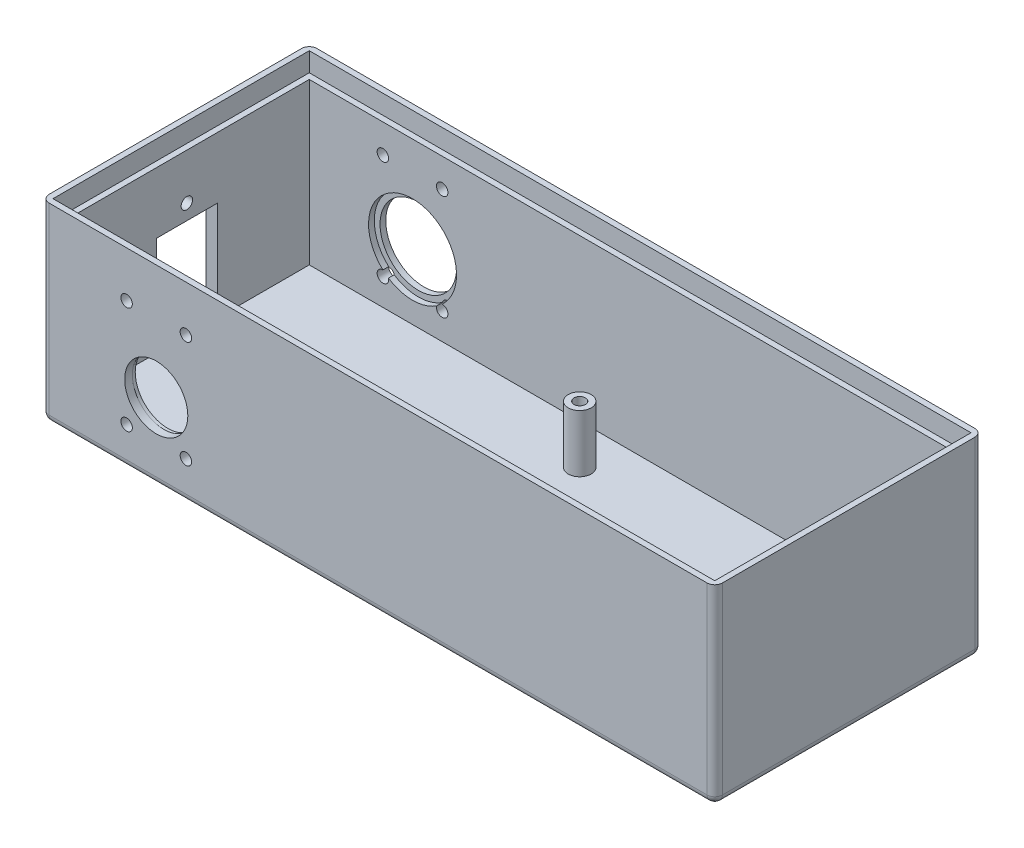
from build123d import *

# Parameters (mm, degrees)
SKETCH1_W           = 176
SKETCH1_H           = 70
BOSS_EXTRUDE1_DEPTH = 50
SKETCH2_W           = 170
SKETCH2_H           = 64
CUT_EXTRUDE1_DEPTH  = 47
SKETCH3_W           = 173
SKETCH3_H           = 67
CUT_EXTRUDE2_DEPTH  = 5
SKETCH4_R           = 3
SKETCH4_R_2         = 1.5
BOSS_EXTRUDE2_DEPTH = 15
CUT_EXTRUDE3_REACH  = 125.061
SKETCH5_R           = 10
SKETCH5_R_2         = 1.5
SKETCH6_R           = 11.5
CUT_EXTRUDE4_DEPTH  = 1.5
CUT_EXTRUDE5_REACH  = 125.061
SKETCH7_R           = 8.25
SKETCH7_R_2         = 1.5
SKETCH8_R           = 8.5
CUT_EXTRUDE6_DEPTH  = 1
FILLET1_R           = 2
CUT_EXTRUDE7_REACH  = 188.282
SKETCH9_R           = 1.5
SKETCH9_R_2         = 1
SKETCH9_W           = 16
SKETCH9_H           = 21


with BuildPart() as part:
    # Sketch1 → Boss-Extrude1 (new body)
    with BuildSketch(Plane(origin=(0, 0, 0), x_dir=(1, 0, 0), z_dir=(0, 1, 0))):
        Rectangle(SKETCH1_W, SKETCH1_H)
    extrude(amount=BOSS_EXTRUDE1_DEPTH)

    # Sketch2 → Cut-Extrude1 (cut)
    with BuildSketch(Plane(origin=(0, 50, 0), x_dir=(1, 0, 0), z_dir=(0, 1, 0))):
        Rectangle(SKETCH2_W, SKETCH2_H)
    extrude(amount=-CUT_EXTRUDE1_DEPTH, mode=Mode.SUBTRACT)

    # Sketch3 → Cut-Extrude2 (cut)
    with BuildSketch(Plane(origin=(0, 50, 0), x_dir=(1, 0, 0), z_dir=(0, 1, 0))):
        Rectangle(SKETCH3_W, SKETCH3_H)
    extrude(amount=-CUT_EXTRUDE2_DEPTH, mode=Mode.SUBTRACT)

    # Sketch4 → Boss-Extrude2 (add)
    # profile 1 of 4: a face of its own
    with BuildSketch(Plane(origin=(0, 3, 0), x_dir=(1, 0, 0), z_dir=(0, 1, 0))):
        with Locations((-4.8, -27)):
            Circle(SKETCH4_R)
        with Locations((-4.8, -27)):
            Circle(SKETCH4_R_2, mode=Mode.SUBTRACT)
    # profile 2 of 4: a face of its own
    with BuildSketch(Plane(origin=(0, 3, 0), x_dir=(1, 0, 0), z_dir=(0, 1, 0))):
        with Locations((78, -27)):
            Circle(SKETCH4_R)
        with Locations((78, -27)):
            Circle(SKETCH4_R_2, mode=Mode.SUBTRACT)
    # profile 3 of 4: a face of its own
    with BuildSketch(Plane(origin=(0, 3, 0), x_dir=(1, 0, 0), z_dir=(0, 1, 0))):
        with Locations((71.2, 21.5)):
            Circle(SKETCH4_R)
        with Locations((71.2, 21.5)):
            Circle(SKETCH4_R_2, mode=Mode.SUBTRACT)
    # profile 4 of 4: a face of its own
    with BuildSketch(Plane(origin=(0, 3, 0), x_dir=(1, 0, 0), z_dir=(0, 1, 0))):
        with Locations((-3.8, 21.5)):
            Circle(SKETCH4_R)
        with Locations((-3.8, 21.5)):
            Circle(SKETCH4_R_2, mode=Mode.SUBTRACT)
    extrude(amount=BOSS_EXTRUDE2_DEPTH)

    # Sketch5 → Cut-Extrude3 (cut, up to next)
    with BuildSketch(Plane(origin=(0, 0, -35), x_dir=(-1, 0, 0), z_dir=(0, 0, -1)), mode=Mode.PRIVATE) as cut_extrude3_sk1:
        with Locations((58, 20)):
            Circle(SKETCH5_R)
    cut_extrude3_tool1 = extrude(cut_extrude3_sk1.sketch, amount=-CUT_EXTRUDE3_REACH, mode=Mode.PRIVATE) & part.part
    # Sketch5 → Cut-Extrude3 (cut, up to next)
    with BuildSketch(Plane(origin=(0, 0, -35), x_dir=(-1, 0, 0), z_dir=(0, 0, -1)), mode=Mode.PRIVATE) as cut_extrude3_sk2:
        with Locations((65.75, 37.5)):
            Circle(SKETCH5_R_2)
    cut_extrude3_tool2 = extrude(cut_extrude3_sk2.sketch, amount=-CUT_EXTRUDE3_REACH, mode=Mode.PRIVATE) & part.part
    # Sketch5 → Cut-Extrude3 (cut, up to next)
    with BuildSketch(Plane(origin=(0, 0, -35), x_dir=(-1, 0, 0), z_dir=(0, 0, -1)), mode=Mode.PRIVATE) as cut_extrude3_sk3:
        with Locations((50.25, 37.5)):
            Circle(SKETCH5_R_2)
    cut_extrude3_tool3 = extrude(cut_extrude3_sk3.sketch, amount=-CUT_EXTRUDE3_REACH, mode=Mode.PRIVATE) & part.part
    # Sketch5 → Cut-Extrude3 (cut, up to next)
    with BuildSketch(Plane(origin=(0, 0, -35), x_dir=(-1, 0, 0), z_dir=(0, 0, -1)), mode=Mode.PRIVATE) as cut_extrude3_sk4:
        with Locations((50.25, 10)):
            Circle(SKETCH5_R_2)
    cut_extrude3_tool4 = extrude(cut_extrude3_sk4.sketch, amount=-CUT_EXTRUDE3_REACH, mode=Mode.PRIVATE) & part.part
    # Sketch5 → Cut-Extrude3 (cut, up to next)
    with BuildSketch(Plane(origin=(0, 0, -35), x_dir=(-1, 0, 0), z_dir=(0, 0, -1)), mode=Mode.PRIVATE) as cut_extrude3_sk5:
        with Locations((65.75, 10)):
            Circle(SKETCH5_R_2)
    cut_extrude3_tool5 = extrude(cut_extrude3_sk5.sketch, amount=-CUT_EXTRUDE3_REACH, mode=Mode.PRIVATE) & part.part
    add(cut_extrude3_tool1.solids().sort_by_distance((-58, 20, -35))[0], mode=Mode.SUBTRACT)
    add(cut_extrude3_tool2.solids().sort_by_distance((-65.75, 37.5, -35))[0], mode=Mode.SUBTRACT)
    add(cut_extrude3_tool3.solids().sort_by_distance((-50.25, 37.5, -35))[0], mode=Mode.SUBTRACT)
    add(cut_extrude3_tool4.solids().sort_by_distance((-50.25, 10, -35))[0], mode=Mode.SUBTRACT)
    add(cut_extrude3_tool5.solids().sort_by_distance((-65.75, 10, -35))[0], mode=Mode.SUBTRACT)

    # Sketch6 → Cut-Extrude4 (cut)
    with BuildSketch(Plane.XY.offset(-32)):
        with Locations((-58, 20)):
            Circle(SKETCH6_R)
    extrude(amount=-CUT_EXTRUDE4_DEPTH, mode=Mode.SUBTRACT)

    # Sketch7 → Cut-Extrude5 (cut, up to next)
    with BuildSketch(Plane.XY.offset(35), mode=Mode.PRIVATE) as cut_extrude5_sk1:
        with Locations((-58, 20)):
            Circle(SKETCH7_R)
    cut_extrude5_tool1 = extrude(cut_extrude5_sk1.sketch, amount=-CUT_EXTRUDE5_REACH, mode=Mode.PRIVATE) & part.part
    # Sketch7 → Cut-Extrude5 (cut, up to next)
    with BuildSketch(Plane.XY.offset(35), mode=Mode.PRIVATE) as cut_extrude5_sk2:
        with Locations((-65.75, 38)):
            Circle(SKETCH7_R_2)
    cut_extrude5_tool2 = extrude(cut_extrude5_sk2.sketch, amount=-CUT_EXTRUDE5_REACH, mode=Mode.PRIVATE) & part.part
    # Sketch7 → Cut-Extrude5 (cut, up to next)
    with BuildSketch(Plane.XY.offset(35), mode=Mode.PRIVATE) as cut_extrude5_sk3:
        with Locations((-50.25, 38)):
            Circle(SKETCH7_R_2)
    cut_extrude5_tool3 = extrude(cut_extrude5_sk3.sketch, amount=-CUT_EXTRUDE5_REACH, mode=Mode.PRIVATE) & part.part
    # Sketch7 → Cut-Extrude5 (cut, up to next)
    with BuildSketch(Plane.XY.offset(35), mode=Mode.PRIVATE) as cut_extrude5_sk4:
        with Locations((-65.75, 10)):
            Circle(SKETCH7_R_2)
    cut_extrude5_tool4 = extrude(cut_extrude5_sk4.sketch, amount=-CUT_EXTRUDE5_REACH, mode=Mode.PRIVATE) & part.part
    # Sketch7 → Cut-Extrude5 (cut, up to next)
    with BuildSketch(Plane.XY.offset(35), mode=Mode.PRIVATE) as cut_extrude5_sk5:
        with Locations((-50.25, 10)):
            Circle(SKETCH7_R_2)
    cut_extrude5_tool5 = extrude(cut_extrude5_sk5.sketch, amount=-CUT_EXTRUDE5_REACH, mode=Mode.PRIVATE) & part.part
    add(cut_extrude5_tool1.solids().sort_by_distance((-58, 20, 35))[0], mode=Mode.SUBTRACT)
    add(cut_extrude5_tool2.solids().sort_by_distance((-65.75, 38, 35))[0], mode=Mode.SUBTRACT)
    add(cut_extrude5_tool3.solids().sort_by_distance((-50.25, 38, 35))[0], mode=Mode.SUBTRACT)
    add(cut_extrude5_tool4.solids().sort_by_distance((-65.75, 10, 35))[0], mode=Mode.SUBTRACT)
    add(cut_extrude5_tool5.solids().sort_by_distance((-50.25, 10, 35))[0], mode=Mode.SUBTRACT)

    # Sketch8 → Cut-Extrude6 (cut)
    with BuildSketch(Plane(origin=(0, 0, 32), x_dir=(-1, 0, 0), z_dir=(0, 0, -1))):
        with Locations((58, 20)):
            Circle(SKETCH8_R)
    extrude(amount=-CUT_EXTRUDE6_DEPTH, mode=Mode.SUBTRACT)

    # Fillet1
    fillet1_edges = [part.edges().sort_by_distance(p)[0] for p in [
        (0, 0, 35),
        (-88, 25, 35),
        (-88, 0, 0),
        (-88, 25, -35),
        (88, 25, 35),
        (88, 0, 0),
        (0, 0, -35),
        (88, 25, -35),
    ]]
    fillet(fillet1_edges, radius=FILLET1_R)

    # Sketch9 → Cut-Extrude7 (cut, up to next)
    with BuildSketch(Plane.ZY.offset(88), mode=Mode.PRIVATE) as cut_extrude7_sk1:
        with Locations((0, 33)):
            Circle(SKETCH9_R)
    cut_extrude7_tool1 = extrude(cut_extrude7_sk1.sketch, amount=-CUT_EXTRUDE7_REACH, mode=Mode.PRIVATE) & part.part
    # Sketch9 → Cut-Extrude7 (cut, up to next)
    with BuildSketch(Plane.ZY.offset(88), mode=Mode.PRIVATE) as cut_extrude7_sk2:
        with Locations((0, 6)):
            Circle(SKETCH9_R_2)
    cut_extrude7_tool2 = extrude(cut_extrude7_sk2.sketch, amount=-CUT_EXTRUDE7_REACH, mode=Mode.PRIVATE) & part.part
    # Sketch9 → Cut-Extrude7 (cut, up to next)
    with BuildSketch(Plane.ZY.offset(88), mode=Mode.PRIVATE) as cut_extrude7_sk3:
        with Locations((0, 18.5)):
            Rectangle(SKETCH9_W, SKETCH9_H)
    cut_extrude7_tool3 = extrude(cut_extrude7_sk3.sketch, amount=-CUT_EXTRUDE7_REACH, mode=Mode.PRIVATE) & part.part
    add(cut_extrude7_tool1.solids().sort_by_distance((-88, 33, 0))[0], mode=Mode.SUBTRACT)
    add(cut_extrude7_tool2.solids().sort_by_distance((-88, 6, 0))[0], mode=Mode.SUBTRACT)
    add(cut_extrude7_tool3.solids().sort_by_distance((-88, 18.5, 0))[0], mode=Mode.SUBTRACT)


solid = part.part
